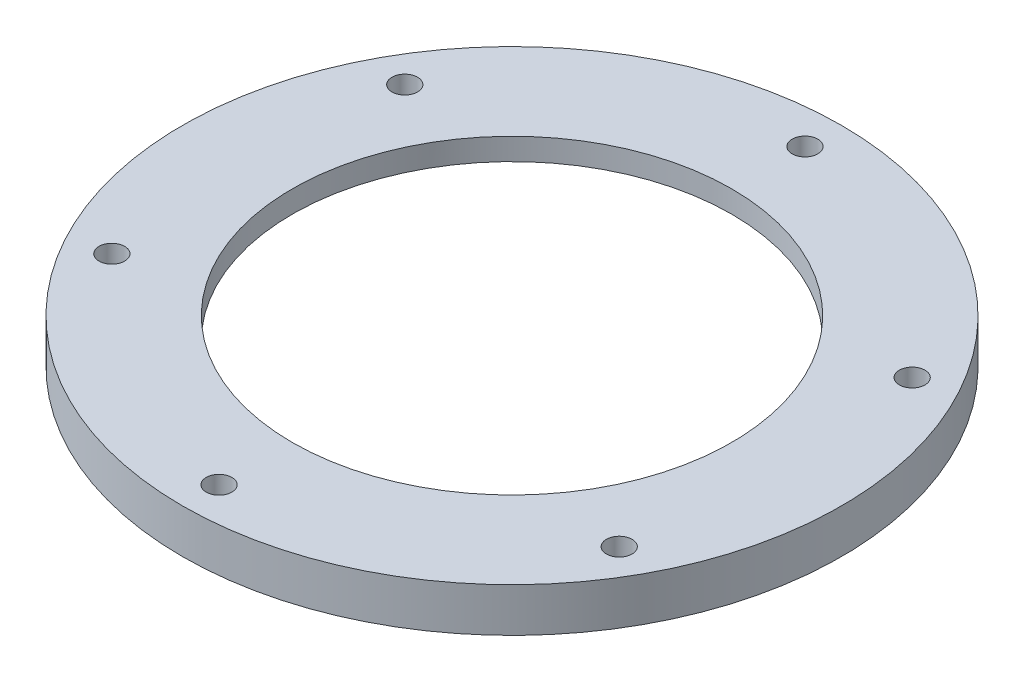
from build123d import *

# Parameters (mm, degrees)
SKETCH1_R           = 45
SKETCH1_R_2         = 30
SKETCH1_R_3         = 1.75
BOSS_EXTRUDE1_DEPTH = 6
SKETCH2_R           = 36
CUT_EXTRUDE1_DEPTH  = 3


with BuildPart() as part:
    # Sketch1 → Boss-Extrude1 (new body)
    with BuildSketch(Plane(origin=(0, 0, 0), x_dir=(1, 0, 0), z_dir=(0, 1, 0))):
        Circle(SKETCH1_R)
        Circle(SKETCH1_R_2, mode=Mode.SUBTRACT)
        with Locations((0, 40)):
            Circle(SKETCH1_R_3, mode=Mode.SUBTRACT)
        with Locations((34.641016151, 20)):
            Circle(SKETCH1_R_3, mode=Mode.SUBTRACT)
        with Locations((34.641016151, -20)):
            Circle(SKETCH1_R_3, mode=Mode.SUBTRACT)
        with Locations((0, -40)):
            Circle(SKETCH1_R_3, mode=Mode.SUBTRACT)
        with Locations((-34.641016151, -20)):
            Circle(SKETCH1_R_3, mode=Mode.SUBTRACT)
        with Locations((-34.641016151, 20)):
            Circle(SKETCH1_R_3, mode=Mode.SUBTRACT)
    extrude(amount=BOSS_EXTRUDE1_DEPTH)

    # Sketch2 → Cut-Extrude1 (cut)
    with BuildSketch(Plane.XZ):
        Circle(SKETCH2_R)
    extrude(amount=-CUT_EXTRUDE1_DEPTH, mode=Mode.SUBTRACT)


solid = part.part
